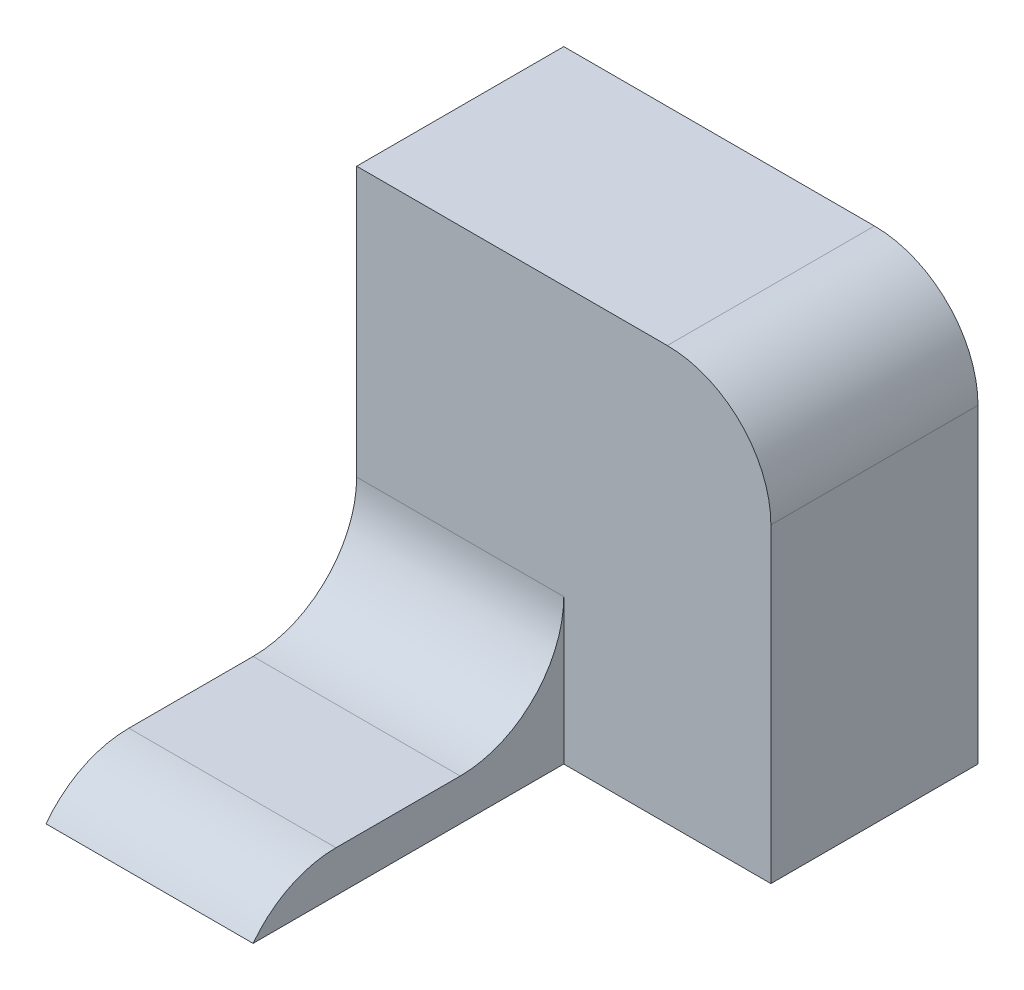
from build123d import *

# Parameters (mm, degrees)
SKETCH1_W           = 20
SKETCH1_H           = 4
BOSS_EXTRUDE1_DEPTH = 30
SKETCH2_W           = 40
SKETCH2_H           = 40
BOSS_EXTRUDE2_DEPTH = 20
FILLET1_R           = 10


with BuildPart() as part:
    # Sketch1 → Boss-Extrude1 (new body)
    with BuildSketch(Plane.XY):
        with Locations((-20, -2)):
            Rectangle(SKETCH1_W, SKETCH1_H)
    extrude(amount=BOSS_EXTRUDE1_DEPTH)

    # Sketch2 → Boss-Extrude2 (add)
    with BuildSketch(Plane.XY):
        with Locations((-10, 16)):
            Rectangle(SKETCH2_W, SKETCH2_H)
    extrude(amount=-BOSS_EXTRUDE2_DEPTH)

    # Fillet1
    # the kernel refuses this fillet: 10 mm, written as the material it adds along each edge
    with BuildSketch(Plane(origin=(-10, 0, 0), x_dir=(0, 1, 0), z_dir=(-1, 0, 0))) as fillet1_piece_1:
        with BuildLine():
            CenterArc((FILLET1_R, -FILLET1_R), FILLET1_R, 90, 90)
            Line((0, -FILLET1_R), (0, 0))
            Line((0, 0), (FILLET1_R, 0))
        make_face()
    extrude(amount=20)
    # the kernel refuses this fillet: 10 mm, written as the material it takes off along each edge
    with BuildSketch(Plane(origin=(10, 36, 25), x_dir=(-1, 0, 0), z_dir=(0, 0, -1))) as fillet1_2_piece_1:
        with BuildLine():
            CenterArc((FILLET1_R, -FILLET1_R), FILLET1_R, 90, 90)
            Line((0, -FILLET1_R), (0, 0))
            Line((0, 0), (FILLET1_R, 0))
        make_face()
    extrude(amount=70, mode=Mode.SUBTRACT)
    with BuildSketch(Plane(origin=(10, 0, 30), x_dir=(0, 0, -1), z_dir=(-1, 0, 0))) as fillet1_2_piece_2:
        with BuildLine():
            CenterArc((8, 10), FILLET1_R, 216.869897646, 53.130102354)
            Line((0, 4), (0, 0))
            Line((0, 0), (8, 0))
        make_face()
    extrude(amount=60, mode=Mode.SUBTRACT)


solid = part.part
